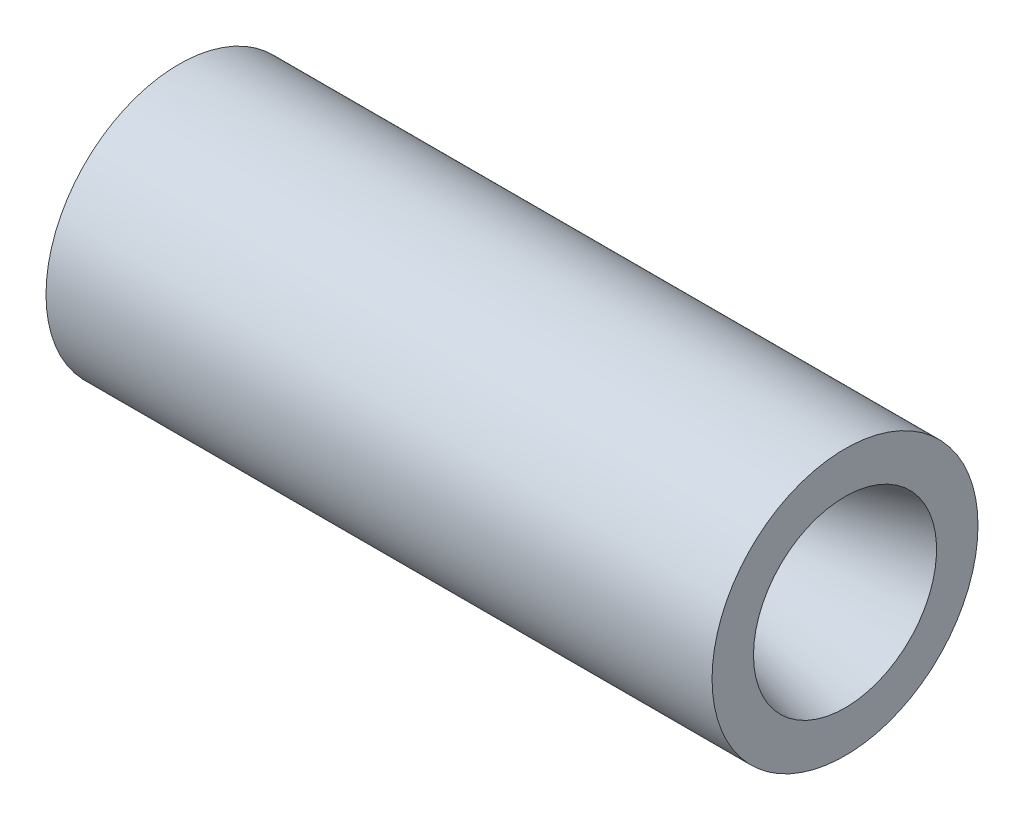
from build123d import *


with BuildPart() as part:
    # Sketch1 → Revolve2 (revolve)
    with BuildSketch(Plane.XY):
        with BuildLine():
            Line((0, 43.2765708), (142.96691498, 43.2765708))
            ThreePointArc((142.96691498, 43.2765708), (148.071235766, 42.49094069), (152.703069491, 40.206773074))
            Line((152.703069491, 40.206773074), (181.498115051, 20.04426511))
            ThreePointArc((181.498115051, 20.04426511), (188.286684234, 17.232347685), (195.627585002, 17.552858335))
            Line((195.627585002, 17.552858335), (267.174286043, 36.7237391))
            Line((267.174286043, 36.7237391), (267.174286043, 53.34))
            Line((267.174286043, 53.34), (0, 53.34))
            Line((0, 53.34), (0, 43.2765708))
        make_face()
    revolve(axis=Axis((0, 0, 0), (1, 0, 0)))


solid = part.part
